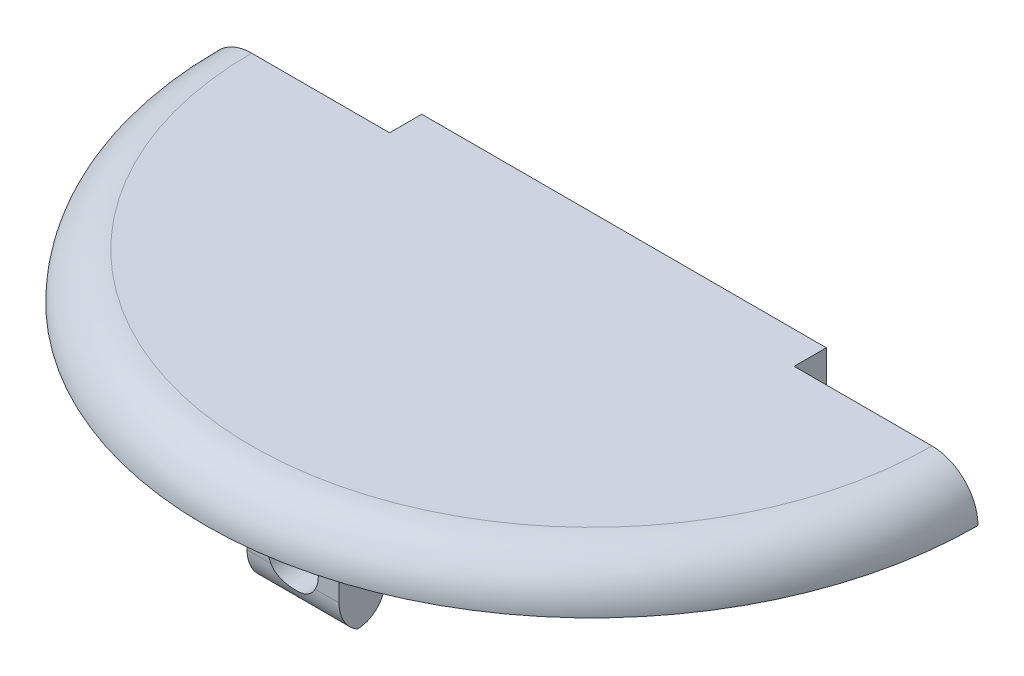
from build123d import *

# Parameters (mm, degrees)
CUT_EXTRUDE1_DEPTH   = 5
CUT_EXTRUDE3_DEPTH   = 45
SKETCH8_R            = 40
CUT_EXTRUDE4_DEPTH   = 32
SKETCH9_R            = 32
SKETCH9_R_2          = 24.5
CUT_EXTRUDE5_DEPTH   = 14
SKETCH10_R           = 26
CUT_EXTRUDE6_DEPTH   = 14
FILLET1_R            = 7
FILLET2_R            = 7
CUT_REVOLVE1_START   = 22
CUT_REVOLVE1_DEPTH   = 30.5
CUT_EXTRUDE12_DEPTH  = 5
SKETCH18_W           = 13
SKETCH18_H           = 8
CUT_EXTRUDE13_DEPTH  = 5
INTERSECT1_OUTLINE_R = 42
INTERSECT1_DEPTH     = 55
SKETCH20_W           = 10
SKETCH20_H           = 5
BOSS_EXTRUDE1_DEPTH  = 13
BOSS_EXTRUDE3_DEPTH  = 7
SKETCH19_R           = 1.5
CUT_EXTRUDE14_DEPTH  = 20
SKETCH23_W           = 20
SKETCH23_H           = 7
CUT_EXTRUDE15_DEPTH  = 7
SKETCH24_W           = 44
SKETCH24_H           = 3.5
CUT_EXTRUDE16_DEPTH  = 5
SKETCH25_R           = 2.75
CUT_EXTRUDE17_DEPTH  = 5
FILLET4_R            = 3
FILLET6_R            = 4


with BuildPart() as part:
    # Sketch1 → Revolve1 (revolve)
    with BuildSketch(Plane.XY, mode=Mode.PRIVATE) as revolve1_sk:
        with BuildLine():
            Line((22.5, 0), (32, 0))
            ThreePointArc((32, 0), (33.414213562, 0.585786438), (34, 2))
            Line((34, 2), (34, 18))
            Line((34, 18), (40, 18))
            ThreePointArc((40, 18), (41.414213562, 18.585786438), (42, 20))
            Line((42, 20), (42, 55))
            ThreePointArc((42, 55), (40.535533906, 58.535533906), (37, 60))
            Line((37, 60), (0, 60))
            Line((0, 60), (0, 18))
            Line((0, 18), (22.5, 18))
            Line((22.5, 18), (22.5, 0))
        make_face()
    revolve(revolve1_sk.sketch.rotate(Axis((0, 2, 0), (0, 1, 0)), 90), axis=Axis((0, 2, 0), (0, 1, 0)))

    # Sketch5 → Cut-Extrude1 (cut)
    with BuildSketch(Plane(origin=(0, 60, 0), x_dir=(1, 0, 0), z_dir=(0, 1, 0))):
        with BuildLine():
            Line((-42, 0), (-40, 0))
            Line((-40, 0), (40, 0))
            Line((40, 0), (42, 0))
            ThreePointArc((42, 0), (0, 42), (-42, 0))
        make_face()
    extrude(amount=-CUT_EXTRUDE1_DEPTH, mode=Mode.SUBTRACT)

    # Sketch7 → Cut-Extrude3 (cut)
    with BuildSketch(Plane.XZ.offset(-18)):
        with BuildLine():
            Line((-21, 0), (21, 0))
            ThreePointArc((21, 0), (0, -21), (-21, 0))
        make_face()
    extrude(amount=-CUT_EXTRUDE3_DEPTH, mode=Mode.SUBTRACT)

    # Sketch8 → Cut-Extrude4 (cut)
    with BuildSketch(Plane(origin=(0, 52.5, 0), x_dir=(1, 0, 0), z_dir=(0, 1, 0))):
        with Locations(Location((0, 0, 0), (0, 0, 270))):
            Circle(SKETCH8_R)
        with BuildLine():
            Line((22.912878475, -2), (-22.912878475, -2))
            ThreePointArc((-22.912878475, -2), (0, 23), (22.912878475, -2))
        make_face(mode=Mode.SUBTRACT)
    extrude(amount=-CUT_EXTRUDE4_DEPTH, mode=Mode.SUBTRACT)

    # Sketch9 → Cut-Extrude5 (cut)
    with BuildSketch(Plane(origin=(0, 2, 0), x_dir=(-1, 0, 0), z_dir=(0, -1, 0))):
        with Locations(Location((0, 0, 0), (0, 0, 90))):
            Circle(SKETCH9_R)
        with Locations(Location((0, 0, 0), (0, 0, 90))):
            Circle(SKETCH9_R_2, mode=Mode.SUBTRACT)
    extrude(amount=-CUT_EXTRUDE5_DEPTH, mode=Mode.SUBTRACT)

    # Sketch10 → Cut-Extrude6 (cut)
    with BuildSketch(Plane(origin=(0, 2, 0), x_dir=(-1, 0, 0), z_dir=(0, -1, 0))):
        Circle(SKETCH10_R)
    extrude(amount=-CUT_EXTRUDE6_DEPTH, mode=Mode.SUBTRACT)

    # Fillet1
    fillet1_edges = [part.edges().sort_by_distance(p)[0] for p in [
        (21, 36.5, 0),
        (-21, 36.5, 0),
    ]]
    fillet(fillet1_edges, radius=FILLET1_R)

    # Fillet2
    fillet2_edges = [part.edges().sort_by_distance(p)[0] for p in [
        (-22.912878475, 36.5, 2),
        (22.912878475, 36.5, 2),
    ]]
    fillet(fillet2_edges, radius=FILLET2_R)

    # Cut-Revolve1: read off the stored shape, not the designer's step
    # Cut-Revolve1 outline → Cut-Revolve1 (cut)
    with BuildSketch(Plane(origin=(0, 0, 0), x_dir=(1, 0, 0), z_dir=(0, 1, 0)).offset(CUT_REVOLVE1_START)):
        with BuildLine():
            Line((-34.641016151, -20), (-36.373066959, -21))
            ThreePointArc((-36.373066959, -21), (0, -42), (36.373066959, -21))
            Line((36.373066959, -21), (34.641016151, -20))
            ThreePointArc((34.641016151, -20), (0, -40), (-34.641016151, -20))
        make_face()
    extrude(amount=CUT_REVOLVE1_DEPTH, mode=Mode.SUBTRACT)

    # Sketch15 → Cut-Extrude12 (cut)
    with BuildSketch(Plane(origin=(0, 20.5, 0), x_dir=(1, 0, 0), z_dir=(0, 1, 0))):
        with BuildLine():
            Line((-28.124355653, -3.514579578), (-26.124355653, -3.514579578))
            ThreePointArc((-26.124355653, -3.514579578), (-24.710142091, -2.928793141), (-24.124355653, -1.514579578))
            Line((-24.124355653, -1.514579578), (-24.124355653, 8.485420422))
            ThreePointArc((-24.124355653, 8.485420422), (-24.710142091, 9.899633984), (-26.124355653, 10.485420422))
            Line((-26.124355653, 10.485420422), (-28.124355653, 10.485420422))
            ThreePointArc((-28.124355653, 10.485420422), (-29.538569215, 9.899633984), (-30.124355653, 8.485420422))
            Line((-30.124355653, 8.485420422), (-30.124355653, -1.514579578))
            ThreePointArc((-30.124355653, -1.514579578), (-29.538569215, -2.928793141), (-28.124355653, -3.514579578))
        make_face()
    extrude(amount=-CUT_EXTRUDE12_DEPTH, mode=Mode.SUBTRACT)

    # Sketch18 → Cut-Extrude13 (cut)
    with BuildSketch(Plane(origin=(0, 55, 0), x_dir=(1, 0, 0), z_dir=(0, 1, 0))):
        with Locations((0.796512215, 32.951769165)):
            Rectangle(SKETCH18_W, SKETCH18_H)
    extrude(amount=-CUT_EXTRUDE13_DEPTH, mode=Mode.SUBTRACT)

    # Intersect1: read off the stored shape, not the designer's step
    # Intersect1 outline → Intersect1 (cut)
    with BuildSketch(Plane(origin=(0, 0, 0), x_dir=(1, 0, 0), z_dir=(0, 1, 0))):
        Circle(INTERSECT1_OUTLINE_R)
        with BuildLine():
            Line((12.124355653, 0), (-12.124355653, 0))
            ThreePointArc((-12.124355653, 0), (-18.186533479, 3.5), (-18.186533479, 10.5))
            ThreePointArc((-18.186533479, 10.5), (0, 21), (18.186533479, 10.5))
            ThreePointArc((18.186533479, 10.5), (18.186533479, 3.5), (12.124355653, 0))
        make_face(mode=Mode.SUBTRACT)
    extrude(amount=INTERSECT1_DEPTH, mode=Mode.SUBTRACT)

    # Sketch20 → Boss-Extrude1 (add)
    with BuildSketch(Plane.XZ.offset(-55)):
        with Locations((0, 30)):
            Rectangle(SKETCH20_W, SKETCH20_H)
    extrude(amount=BOSS_EXTRUDE1_DEPTH)

    # Sketch22 → Boss-Extrude3 (add)
    with BuildSketch(Plane(origin=(0, 0, 0), x_dir=(-1, 0, 0), z_dir=(0, 0, -1))):
        with BuildLine():
            Line((-42, 55), (42, 55))
            ThreePointArc((42, 55), (40.535533906, 58.535533906), (37, 60))
            Line((37, 60), (-37, 60))
            ThreePointArc((-37, 60), (-40.535533906, 58.535533906), (-42, 55))
        make_face()
    extrude(amount=BOSS_EXTRUDE3_DEPTH)

    # Sketch19 → Cut-Extrude14 (cut)
    with BuildSketch(Plane(origin=(0, 0, -7), x_dir=(-1, 0, 0), z_dir=(0, 0, -1))):
        with Locations((0, 57.5)):
            Circle(SKETCH19_R)
        with Locations((-29.45, 57.5)):
            Circle(SKETCH19_R)
        with Locations((29.45, 57.5)):
            Circle(SKETCH19_R)
    extrude(amount=-CUT_EXTRUDE14_DEPTH, mode=Mode.SUBTRACT)

    # Sketch23 → Cut-Extrude15 (cut)
    with BuildSketch(Plane(origin=(0, 60, 0), x_dir=(1, 0, 0), z_dir=(0, 1, 0))):
        with Locations((-32, 3.5)):
            Rectangle(SKETCH23_W, SKETCH23_H)
        with Locations((32, 3.5)):
            Rectangle(SKETCH23_W, SKETCH23_H)
    extrude(amount=-CUT_EXTRUDE15_DEPTH, mode=Mode.SUBTRACT)

    # Sketch24 → Cut-Extrude16 (cut)
    with BuildSketch(Plane(origin=(0, 60, 0), x_dir=(1, 0, 0), z_dir=(0, 1, 0))):
        with Locations((0, 5.25)):
            Rectangle(SKETCH24_W, SKETCH24_H)
    extrude(amount=-CUT_EXTRUDE16_DEPTH, mode=Mode.SUBTRACT)

    # Sketch25 → Cut-Extrude17 (cut)
    with BuildSketch(Plane(origin=(0, 0, 27.5), x_dir=(-1, 0, 0), z_dir=(0, 0, -1))):
        with Locations((0, 46.8)):
            Circle(SKETCH25_R)
    extrude(amount=-CUT_EXTRUDE17_DEPTH, mode=Mode.SUBTRACT)

    # Fillet4
    # the kernel refuses this fillet: 3 mm, written as the material it takes off along each edge
    with BuildSketch(Plane(origin=(12.5, 42, 27.5), x_dir=(0, 1, 0), z_dir=(-1, 0, 0))) as fillet4_piece_1:
        with BuildLine():
            CenterArc((FILLET4_R, -FILLET4_R), FILLET4_R, 90, 90)
            Line((0, -FILLET4_R), (0, 0))
            Line((0, 0), (FILLET4_R, 0))
        make_face()
    extrude(amount=25, mode=Mode.SUBTRACT)

    # Fillet6
    # the kernel refuses this fillet: 4 mm, written as the material it takes off along each edge
    with BuildSketch(Plane(origin=(-13.660254038, 42, 32.5), x_dir=(0, 1, 0), z_dir=(1, 0, 0))) as fillet6_piece_1:
        with BuildLine():
            CenterArc((3.464101615, -4), FILLET6_R, 90, 60)
            Line((0, -2), (0, 0))
            Line((0, 0), (3.464101615, 0))
        make_face()
    extrude(amount=27.320508076, mode=Mode.SUBTRACT)


solid = part.part
